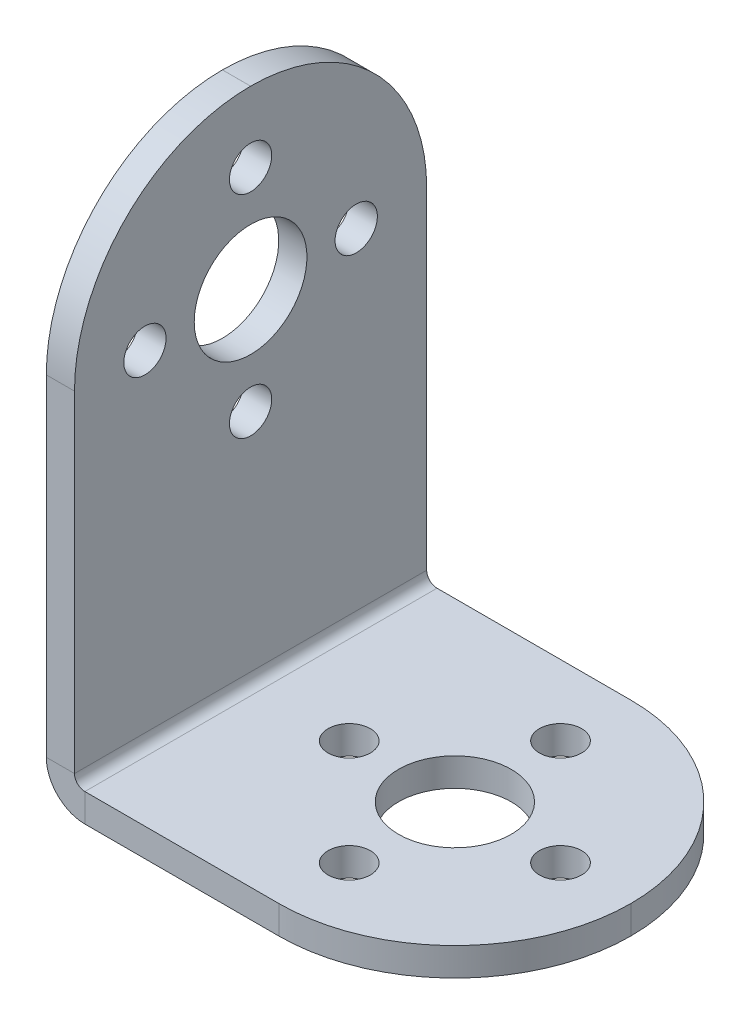
from build123d import *

# Parameters (mm, degrees)
SKETCH1_R                    = 1.5
SKETCH1_R_2                  = 4
BASE_FLANGE1_DEPTH           = 2
SKETCHED_START               = -32.5
SKETCHED_BEND1_OUTLINE_W     = 2
SKETCHED_BEND1_OUTLINE_H     = 25
SKETCHED_BEND1_DEPTH         = 36
SKETCHED_START_2             = 3.766161716
SKETCHED_BEND1_2_OUTLINE_R   = 1.5
SKETCHED_BEND1_2_OUTLINE_R_2 = 4
SKETCHED_BEND1_2_DEPTH       = 1.733838284
SKETCHED_START_3             = 3.5
SKETCHED_BEND1_3_OUTLINE_R   = 1.5
SKETCHED_BEND1_3_OUTLINE_R_2 = 4
SKETCHED_BEND1_3_DEPTH       = 2.7366
SKETCHED_START_4             = -12.5
SKETCHED_BEND1_4_DEPTH       = 25


with BuildPart() as part:
    # Base-Flange1: sheet metal written as solids
    # Sketch1 → Base-Flange1 (new body)
    with BuildSketch(Plane(origin=(0, 0, 0), x_dir=(1, 0, 0), z_dir=(0, 1, 0))):
        with BuildLine():
            Line((-32.5, -0.001), (-32.5, 0.001))
            ThreePointArc((-32.5, 0.001), (-28.839127658, 8.839127658), (-20.001, 12.5))
            Line((-20.001, 12.5), (20.001, 12.5))
            ThreePointArc((20.001, 12.5), (28.839127658, 8.839127658), (32.5, 0.001))
            Line((32.5, 0.001), (32.5, -0.001))
            ThreePointArc((32.5, -0.001), (28.839127658, -8.839127658), (20.001, -12.5))
            Line((20.001, -12.5), (-20.001, -12.5))
            ThreePointArc((-20.001, -12.5), (-28.839127658, -8.839127658), (-32.5, -0.001))
        make_face()
        with Locations(Location((12.501, 0.000250009, 0), (0, 0, 270))):
            Circle(SKETCH1_R, mode=Mode.SUBTRACT)
        with Locations(Location((20.001, 0.000250009, 0), (0, 0, 270))):
            Circle(SKETCH1_R_2, mode=Mode.SUBTRACT)
        with Locations(Location((20.001, -7.499749991, 0), (0, 0, 270))):
            Circle(SKETCH1_R, mode=Mode.SUBTRACT)
        with Locations(Location((27.501, 0.000250009, 0), (0, 0, 270))):
            Circle(SKETCH1_R, mode=Mode.SUBTRACT)
        with Locations(Location((20.001, 7.500250009, 0), (0, 0, 270))):
            Circle(SKETCH1_R, mode=Mode.SUBTRACT)
        with Locations(Location((-20.001, 7.499, 0), (0, 0, 270))):
            Circle(SKETCH1_R, mode=Mode.SUBTRACT)
        with Locations(Location((-27.500999963, -0.000250009, 0), (0, 0, 270))):
            Circle(SKETCH1_R, mode=Mode.SUBTRACT)
        with Locations(Location((-12.501000067, 0, 0), (0, 0, 270))):
            Circle(SKETCH1_R, mode=Mode.SUBTRACT)
        with Locations(Location((-20.001, -7.501, 0), (0, 0, 270))):
            Circle(SKETCH1_R, mode=Mode.SUBTRACT)
        with Locations(Location((-20.001, -0.001, 0), (0, 0, 270))):
            Circle(SKETCH1_R_2, mode=Mode.SUBTRACT)
    extrude(amount=-BASE_FLANGE1_DEPTH)

    # Sketched Bend1: read off the stored shape, not the designer's step
    # Sketched Bend1 outline → Sketched Bend1 (cut)
    with BuildSketch(Plane.YZ.offset(SKETCHED_START)):
        with Locations((-1, 0)):
            Rectangle(SKETCHED_BEND1_OUTLINE_W, SKETCHED_BEND1_OUTLINE_H)
    extrude(amount=SKETCHED_BEND1_DEPTH, mode=Mode.SUBTRACT)

    # Sketched Bend1 2 outline → Sketched Bend1 2 (add)
    with BuildSketch(Plane.YZ.offset(SKETCHED_START_2)):
        with BuildLine():
            ThreePointArc((36.745355099, 0.001), (33.084482757, 8.839127658), (24.246355099, 12.5))
            Line((24.246355099, 12.5), (0, 12.5))
            Line((0, 12.5), (0, -12.5))
            Line((0, -12.5), (24.246355099, -12.5))
            ThreePointArc((24.246355099, -12.5), (33.084482757, -8.839127658), (36.745355099, -0.001))
            Line((36.745355099, -0.001), (36.745355099, 0.001))
        make_face()
        with Locations((24.246355099, -7.499)):
            Circle(SKETCHED_BEND1_2_OUTLINE_R, mode=Mode.SUBTRACT)
        with Locations((16.746355166, 0)):
            Circle(SKETCHED_BEND1_2_OUTLINE_R, mode=Mode.SUBTRACT)
        with Locations((24.246355099, 0.001)):
            Circle(SKETCHED_BEND1_2_OUTLINE_R_2, mode=Mode.SUBTRACT)
        with Locations((31.746355061, 0.000250009)):
            Circle(SKETCHED_BEND1_2_OUTLINE_R, mode=Mode.SUBTRACT)
        with Locations((24.246355099, 7.501)):
            Circle(SKETCHED_BEND1_2_OUTLINE_R, mode=Mode.SUBTRACT)
    extrude(amount=SKETCHED_BEND1_2_DEPTH)

    # Sketched Bend1 3 outline → Sketched Bend1 3 (add)
    with BuildSketch(Plane.YZ.offset(SKETCHED_START_3)):
        with BuildLine():
            ThreePointArc((36.745355099, 0.001), (33.084482757, 8.839127658), (24.246355099, 12.5))
            Line((24.246355099, 12.5), (0, 12.5))
            Line((0, 12.5), (0, -12.5))
            Line((0, -12.5), (24.246355099, -12.5))
            ThreePointArc((24.246355099, -12.5), (33.084482757, -8.839127658), (36.745355099, -0.001))
            Line((36.745355099, -0.001), (36.745355099, 0.001))
        make_face()
        with Locations((24.246355099, -7.499)):
            Circle(SKETCHED_BEND1_3_OUTLINE_R, mode=Mode.SUBTRACT)
        with Locations((16.746355166, 0)):
            Circle(SKETCHED_BEND1_3_OUTLINE_R, mode=Mode.SUBTRACT)
        with Locations((24.246355099, 0.001)):
            Circle(SKETCHED_BEND1_3_OUTLINE_R_2, mode=Mode.SUBTRACT)
        with Locations((31.746355061, 0.000250009)):
            Circle(SKETCHED_BEND1_3_OUTLINE_R, mode=Mode.SUBTRACT)
        with Locations((24.246355099, 7.501)):
            Circle(SKETCHED_BEND1_3_OUTLINE_R, mode=Mode.SUBTRACT)
    extrude(amount=SKETCHED_BEND1_3_DEPTH)

    # Sketched Bend1 4 outline → Sketched Bend1 4 (cut)
    with BuildSketch(Plane.XY.offset(SKETCHED_START_4)):
        with BuildLine():
            ThreePointArc((6.2366, -2), (4.301531583, -1.198468417), (3.5, 0.7366))
            Line((3.5, 0.7366), (3.5, -2))
            Line((3.5, -2), (6.2366, -2))
        make_face()
        with BuildLine():
            Line((5.5, 36.745355099), (5.5, 0.7366))
            ThreePointArc((5.5, 0.7366), (5.715745145, 0.215745145), (6.2366, 0))
            Line((6.2366, 0), (6.2366, 36.745355099))
            Line((6.2366, 36.745355099), (5.5, 36.745355099))
        make_face()
    extrude(amount=SKETCHED_BEND1_4_DEPTH, mode=Mode.SUBTRACT)


solid = part.part
